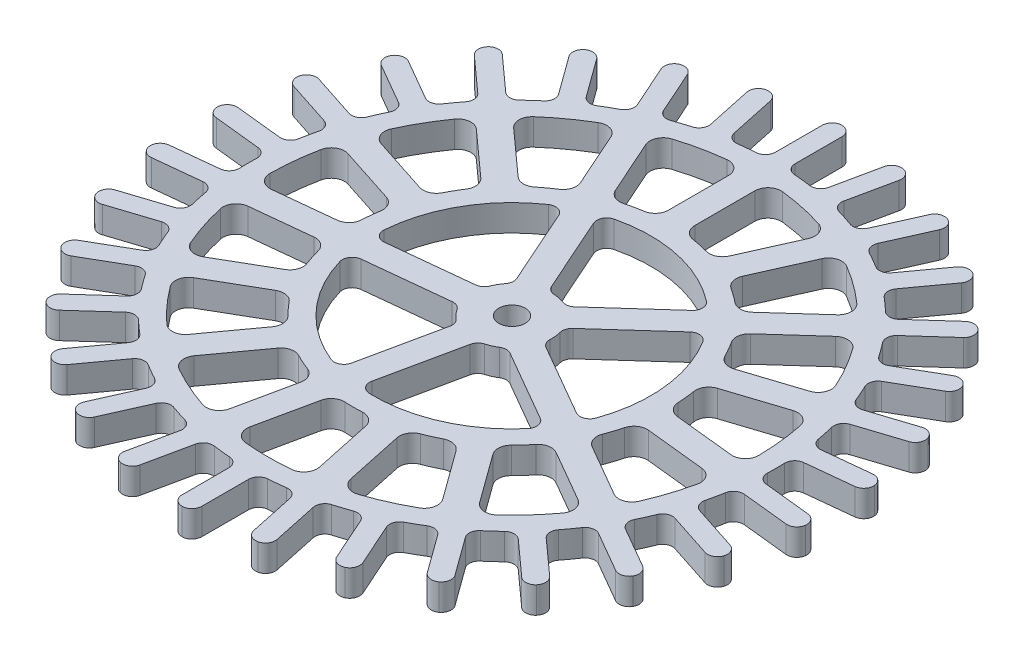
from build123d import *

# Parameters (mm, degrees)
SKETCH1_R                = 127
BOSS_EXTRUDE1_DEPTH      = 12.7
BOSS_EXTRUDE2_START      = -12.7
BOSS_EXTRUDE2_DEPTH      = 12.7
FILLET1_R                = 4.7625
CIRPATTERN1_COUNT        = 30
FILLET1_OF_CIRPATTERN1_R = 4.7625
SKETCH3_R                = 6.35
CUT_EXTRUDE1_DEPTH       = 225.144812995
CUT_EXTRUDE2_DEPTH       = 225.144812995
FILLET2_R                = 6.35
CIRPATTERN3_COUNT        = 15
FILLET2_OF_CIRPATTERN3_R = 6.35
CUT_EXTRUDE3_DEPTH       = 225.144812995
FILLET3_R                = 4.7625
CIRPATTERN5_COUNT        = 5
FILLET3_OF_CIRPATTERN5_R = 4.7625


with BuildPart() as part:
    # Sketch1 → Boss-Extrude1 (new body)
    with BuildSketch(Plane(origin=(0, 0, 0), x_dir=(1, 0, 0), z_dir=(0, 1, 0))):
        with Locations(Location((0, 0, 0), (0, 0, 270))):
            Circle(SKETCH1_R)
    extrude(amount=BOSS_EXTRUDE1_DEPTH)

    # Sketch2 → Boss-Extrude2 (add)
    with BuildSketch(Plane(origin=(0, 12.7, 0), x_dir=(1, 0, 0), z_dir=(0, 1, 0)).offset(BOSS_EXTRUDE2_START)):
        with BuildLine():
            Line((4.7625, 158.660671709), (0, 158.660671709))
            Line((0, 158.660671709), (0, 127))
            ThreePointArc((0, 127), (2.381668837, 126.977665964), (4.7625, 126.910671709))
            Line((4.7625, 126.910671709), (4.7625, 158.660671709))
        make_face()
        with BuildLine():
            Line((0, 127), (0, 158.660671709))
            Line((0, 158.660671709), (-4.7625, 158.660671709))
            Line((-4.7625, 158.660671709), (-4.7625, 126.910671709))
            ThreePointArc((-4.7625, 126.910671709), (-2.381668837, 126.977665964), (0, 127))
        make_face()
    boss_extrude2 = extrude(amount=BOSS_EXTRUDE2_DEPTH)

    # Fillet1
    fillet1_edges = [part.edges().sort_by_distance(p)[0] for p in [
        (-4.7625, 6.35, -158.660671709),
        (-4.7625, 6.35, -126.910671709),
        (4.7625, 6.35, -126.910671709),
        (4.7625, 6.35, -158.660671709),
    ]]
    fillet(fillet1_edges, radius=FILLET1_R - 0.0001)  # a hair under: the kernel refuses the full size

    # CirPattern1: Boss-Extrude2 ×30 about axis
    cirpattern1_axis = Axis((0, 0, 0), (0, 1, 0))
    for i in range(1, CIRPATTERN1_COUNT):
        add(boss_extrude2.rotate(cirpattern1_axis, i * 360 / CIRPATTERN1_COUNT))

    # Fillet1 of CirPattern1
    fillet1_of_cirpattern1_edges = [part.edges().sort_by_distance(p)[0] for p in [
        (-37.64583647, 6.35, -154.203375936),
        (-31.044640286, 6.35, -123.147189613),
        (-21.727784389, 6.35, -125.127548468),
        (-28.328980573, 6.35, -156.183734791),
        (-68.883869241, 6.35, -143.006652684),
        (-55.969980824, 6.35, -114.001584404),
        (-47.26846034, 6.35, -117.875750929),
        (-60.182348757, 6.35, -146.880819209),
        (-97.111346385, 6.35, -125.559852488),
        (-78.449164625, 6.35, -99.873562916),
        (-70.743277754, 6.35, -105.472217445),
        (-89.405459514, 6.35, -131.158507016),
        (-121.0945917, 6.35, -102.625484235),
        (-97.499743492, 6.35, -81.380587483),
        (-91.126274466, 6.35, -88.459041946),
        (-114.721122675, 6.35, -109.703938698),
        (-139.785422282, 6.35, -75.205889869),
        (-112.289115712, 6.35, -59.330889869),
        (-107.526615712, 6.35, -67.57978184),
        (-135.022922282, 6.35, -83.45478184),
        (-152.366959145, 6.35, -44.499437238),
        (-122.170914752, 6.35, -34.688147667),
        (-119.227527881, 6.35, -43.746960985),
        (-149.423572273, 6.35, -53.558250556),
        (-158.289328755, 6.35, -11.848145668),
        (-126.713258577, 6.35, -8.529366959),
        (-125.717624965, 6.35, -18.002188013),
        (-157.293695143, 6.35, -21.320966721),
        (-157.293695143, 6.35, 21.320966721),
        (-125.717624965, 6.35, 18.002188013),
        (-126.713258577, 6.35, 8.529366959),
        (-158.289328755, 6.35, 11.848145668),
        (-149.423572273, 6.35, 53.558250556),
        (-119.227527881, 6.35, 43.746960985),
        (-122.170914752, 6.35, 34.688147667),
        (-152.366959145, 6.35, 44.499437238),
        (-135.022922282, 6.35, 83.45478184),
        (-107.526615712, 6.35, 67.57978184),
        (-112.289115712, 6.35, 59.330889869),
        (-139.785422282, 6.35, 75.205889869),
        (-114.721122675, 6.35, 109.703938698),
        (-91.126274466, 6.35, 88.459041946),
        (-97.499743492, 6.35, 81.380587483),
        (-121.0945917, 6.35, 102.625484235),
        (-89.405459514, 6.35, 131.158507016),
        (-70.743277754, 6.35, 105.472217445),
        (-78.449164625, 6.35, 99.873562916),
        (-97.111346385, 6.35, 125.559852488),
        (-60.182348757, 6.35, 146.880819209),
        (-47.26846034, 6.35, 117.875750929),
        (-55.969980824, 6.35, 114.001584404),
        (-68.883869241, 6.35, 143.006652684),
        (-28.328980573, 6.35, 156.183734791),
        (-21.727784389, 6.35, 125.127548468),
        (-31.044640286, 6.35, 123.147189613),
        (-37.64583647, 6.35, 154.203375936),
        (4.7625, 6.35, 158.660671709),
        (4.7625, 6.35, 126.910671709),
        (-4.7625, 6.35, 126.910671709),
        (-4.7625, 6.35, 158.660671709),
        (37.64583647, 6.35, 154.203375936),
        (31.044640286, 6.35, 123.147189613),
        (21.727784389, 6.35, 125.127548468),
        (28.328980573, 6.35, 156.183734791),
        (68.883869241, 6.35, 143.006652684),
        (55.969980824, 6.35, 114.001584404),
        (47.26846034, 6.35, 117.875750929),
        (60.182348757, 6.35, 146.880819209),
        (97.111346385, 6.35, 125.559852488),
        (78.449164625, 6.35, 99.873562916),
        (70.743277754, 6.35, 105.472217445),
        (89.405459514, 6.35, 131.158507016),
        (121.0945917, 6.35, 102.625484235),
        (97.499743492, 6.35, 81.380587483),
        (91.126274466, 6.35, 88.459041946),
        (114.721122675, 6.35, 109.703938698),
        (139.785422282, 6.35, 75.205889869),
        (112.289115712, 6.35, 59.330889869),
        (107.526615712, 6.35, 67.57978184),
        (135.022922282, 6.35, 83.45478184),
        (152.366959145, 6.35, 44.499437238),
        (122.170914752, 6.35, 34.688147667),
        (119.227527881, 6.35, 43.746960985),
        (149.423572273, 6.35, 53.558250556),
        (158.289328755, 6.35, 11.848145668),
        (126.713258577, 6.35, 8.529366959),
        (125.717624965, 6.35, 18.002188013),
        (157.293695143, 6.35, 21.320966721),
        (157.293695143, 6.35, -21.320966721),
        (125.717624965, 6.35, -18.002188013),
        (126.713258577, 6.35, -8.529366959),
        (158.289328755, 6.35, -11.848145668),
        (149.423572273, 6.35, -53.558250556),
        (119.227527881, 6.35, -43.746960985),
        (122.170914752, 6.35, -34.688147667),
        (152.366959145, 6.35, -44.499437238),
        (135.022922282, 6.35, -83.45478184),
        (107.526615712, 6.35, -67.57978184),
        (112.289115712, 6.35, -59.330889869),
        (139.785422282, 6.35, -75.205889869),
        (114.721122675, 6.35, -109.703938698),
        (91.126274466, 6.35, -88.459041946),
        (97.499743492, 6.35, -81.380587483),
        (121.0945917, 6.35, -102.625484235),
        (89.405459514, 6.35, -131.158507016),
        (70.743277754, 6.35, -105.472217445),
        (78.449164625, 6.35, -99.873562916),
        (97.111346385, 6.35, -125.559852488),
        (60.182348757, 6.35, -146.880819209),
        (47.26846034, 6.35, -117.875750929),
        (55.969980824, 6.35, -114.001584404),
        (68.883869241, 6.35, -143.006652684),
        (28.328980573, 6.35, -156.183734791),
        (21.727784389, 6.35, -125.127548468),
        (31.044640286, 6.35, -123.147189613),
        (37.64583647, 6.35, -154.203375936),
    ]]
    fillet(fillet1_of_cirpattern1_edges, radius=FILLET1_OF_CIRPATTERN1_R - 0.0001)  # a hair under: the kernel refuses the full size

    # Sketch3 → Cut-Extrude1 (cut, through all)
    with BuildSketch(Plane(origin=(0, 12.7, 0), x_dir=(1, 0, 0), z_dir=(0, 1, 0))):
        with Locations(Location((0, 0, 0), (0, 0, 270))):
            Circle(SKETCH3_R)
    extrude(amount=-CUT_EXTRUDE1_DEPTH, mode=Mode.SUBTRACT)

    # Sketch4 → Cut-Extrude2 (cut, through all)
    with BuildSketch(Plane(origin=(0, 12.7, 0), x_dir=(1, 0, 0), z_dir=(0, 1, 0))):
        with BuildLine():
            Line((41.910517623, 109.744631475), (25.084515325, 71.952811557))
            ThreePointArc((25.084515325, 71.952811557), (15.84287084, 74.534847176), (6.35, 75.934955719))
            Line((6.35, 75.934955719), (6.35, 117.303252832))
            ThreePointArc((6.35, 117.303252832), (24.424425879, 114.907889396), (41.910517623, 109.744631475))
        make_face()
    cut_extrude2 = extrude(amount=-CUT_EXTRUDE2_DEPTH, mode=Mode.SUBTRACT)

    # Fillet2
    fillet2_edges = [part.edges().sort_by_distance(p)[0] for p in [
        (6.35, 6.35, -75.934955719),
        (6.35, 6.35, -117.303252832),
        (41.910517623, 6.35, -109.744631475),
        (25.084515325, 6.35, -71.952811557),
    ]]
    fillet(fillet2_edges, radius=FILLET2_R)

    # CirPattern3: Cut-Extrude2 ×15 about axis
    cirpattern3_axis = Axis((0, 0, 0), (0, 1, 0))
    for i in range(1, CIRPATTERN3_COUNT):
        add(cut_extrude2.rotate(cirpattern3_axis, i * 360 / CIRPATTERN3_COUNT), mode=Mode.SUBTRACT)

    # Fillet2 of CirPattern3
    fillet2_of_cirpattern3_edges = [part.edges().sort_by_distance(p)[0] for p in [
        (-25.084515325, 6.35, -71.952811557),
        (-41.910517623, 6.35, -109.744631475),
        (-6.35, 6.35, -117.303252832),
        (-6.35, 6.35, -75.934955719),
        (-52.181690065, 6.35, -55.529372606),
        (-82.924326003, 6.35, -83.210166337),
        (-53.512544935, 6.35, -104.579076108),
        (-36.686542637, 6.35, -66.78725619),
        (-70.256176537, 6.35, -29.504400663),
        (-109.599765074, 6.35, -42.287907499),
        (-91.422284704, 6.35, -73.772227054),
        (-60.679648766, 6.35, -46.091433322),
        (-76.182731828, 6.35, 1.622150194),
        (-117.324409081, 6.35, 5.946314719),
        (-113.524280903, 6.35, -30.209489742),
        (-74.180692365, 6.35, -17.425982906),
        (-68.936600688, 6.35, 32.468216545),
        (-104.762596899, 6.35, 53.152365102),
        (-115.996897598, 6.35, 18.57674279),
        (-74.855220344, 6.35, 14.252578265),
        (-49.770705019, 6.35, 57.700233291),
        (-74.086379975, 6.35, 91.167888685),
        (-98.412596899, 6.35, 64.15088773),
        (-62.586600688, 6.35, 43.466739173),
        (-21.9990023, 6.35, 72.955355511),
        (-30.599954899, 6.35, 113.419656079),
        (-63.811864146, 6.35, 98.632761389),
        (-39.496189191, 6.35, 65.165105996),
        (9.576527771, 6.35, 75.595833985),
        (18.17748037, 6.35, 116.060134553),
        (-18.17748037, 6.35, 116.060134553),
        (-9.576527771, 6.35, 75.595833985),
        (39.496189191, 6.35, 65.165105996),
        (63.811864146, 6.35, 98.632761389),
        (30.599954899, 6.35, 113.419656079),
        (21.9990023, 6.35, 72.955355511),
        (62.586600688, 6.35, 43.466739173),
        (98.412596899, 6.35, 64.15088773),
        (74.086379975, 6.35, 91.167888685),
        (49.770705019, 6.35, 57.700233291),
        (74.855220344, 6.35, 14.252578265),
        (115.996897598, 6.35, 18.57674279),
        (104.762596899, 6.35, 53.152365102),
        (68.936600688, 6.35, 32.468216545),
        (74.180692365, 6.35, -17.425982906),
        (113.524280903, 6.35, -30.209489742),
        (117.324409081, 6.35, 5.946314719),
        (76.182731828, 6.35, 1.622150194),
        (60.679648766, 6.35, -46.091433322),
        (91.422284704, 6.35, -73.772227054),
        (109.599765074, 6.35, -42.287907499),
        (70.256176537, 6.35, -29.504400663),
        (36.686542637, 6.35, -66.78725619),
        (53.512544935, 6.35, -104.579076108),
        (82.924326003, 6.35, -83.210166337),
        (52.181690065, 6.35, -55.529372606),
    ]]
    fillet(fillet2_of_cirpattern3_edges, radius=FILLET2_OF_CIRPATTERN3_R)

    # Sketch6 → Cut-Extrude3 (cut, through all)
    with BuildSketch(Plane(origin=(0, 12.7, 0), x_dir=(1, 0, 0), z_dir=(0, 1, 0))):
        with BuildLine():
            Line((-21.194882448, 63.216553078), (-1.504184801, 18.990522059))
            ThreePointArc((-1.504184801, 18.990522059), (3.96071771, 18.633711794), (9.098282385, 16.736898089))
            Line((9.098282385, 16.736898089), (45.074977171, 49.130459575))
            ThreePointArc((45.074977171, 49.130459575), (13.862511985, 65.217991279), (-21.194882448, 63.216553078))
        make_face()
    cut_extrude3 = extrude(amount=-CUT_EXTRUDE3_DEPTH, mode=Mode.SUBTRACT)

    # Fillet3
    fillet3_edges = [part.edges().sort_by_distance(p)[0] for p in [
        (-21.194882448, 6.35, -63.216553078),
        (45.074977171, 6.35, -49.130459575),
        (9.098282385, 6.35, -16.736898089),
        (-1.504184801, 6.35, -18.990522059),
    ]]
    fillet(fillet3_edges, radius=FILLET3_R)

    # CirPattern5: Cut-Extrude3 ×5 about axis
    cirpattern5_axis = Axis((0, 0, 0), (0, 1, 0))
    for i in range(1, CIRPATTERN5_COUNT):
        add(cut_extrude3.rotate(cirpattern5_axis, i * 360 / CIRPATTERN5_COUNT), mode=Mode.SUBTRACT)

    # Fillet3 of CirPattern5
    fillet3_of_cirpattern5_edges = [part.edges().sort_by_distance(p)[0] for p in [
        (-66.672093612, 6.35, 0.622541837),
        (-32.79690976, 6.35, -58.050997711),
        (-13.106212113, 6.35, -13.824966692),
        (-18.525878419, 6.35, -4.437829291),
        (-20.010737506, 6.35, 63.601305093),
        (-65.344582129, 6.35, 13.252969909),
        (-17.198366935, 6.35, 8.19259878),
        (-9.945437733, 6.35, 16.247792721),
        (54.304777694, 6.35, 38.685226439),
        (-7.588262976, 6.35, 66.241783566),
        (2.477036796, 6.35, 18.888271194),
        (12.379259867, 6.35, 14.479517435),
        (53.572935872, 6.35, -39.692520291),
        (60.654777694, 6.35, 27.686703811),
        (18.729259867, 6.35, 3.480994807),
        (17.596241086, 6.35, -7.298958805),
    ]]
    fillet(fillet3_of_cirpattern5_edges, radius=FILLET3_OF_CIRPATTERN5_R)


solid = part.part
